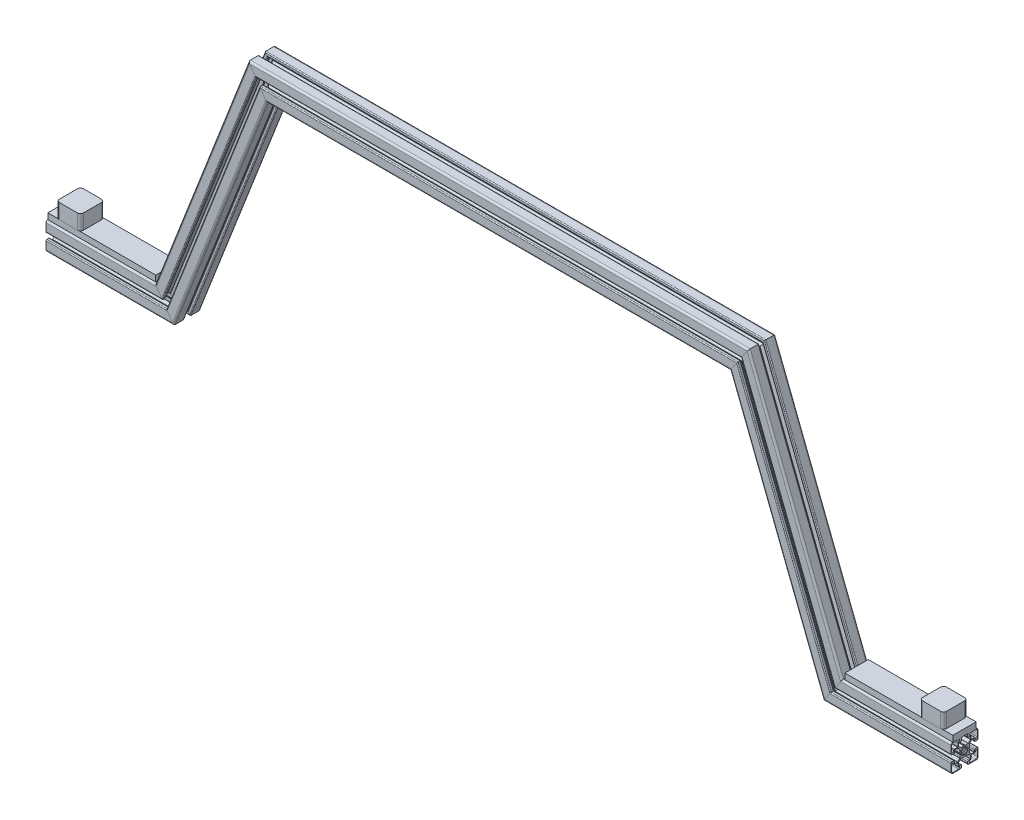
from build123d import *

# Parameters (mm, degrees)
SKETCH3_W            = 180.28743450691564
SKETCH3_H            = 38.99999999999999
BOSS_EXTRUDE1_DEPTH  = 10
BOSS_EXTRUDE2_DEPTH  = 25
FILLET1_R            = 5
FILLET1_OF_MIRROR1_R = 5


with BuildPart() as part:
    # Sweep1: sweep along a path in Sketch1
    with BuildLine(Plane.XY) as sweep1_path:
        Line((0, 0), (200, 0))
        Line((200, 0), (355.8974358974359, 400))
        Line((355.8974358974359, 400), (755.8974358974359, 400))
    # Sketch5 → Sweep1 (sweep)
    with BuildSketch(Plane(origin=(0, 0, 0), x_dir=(0, 0, -1), z_dir=(1, 0, 0))):
        with BuildLine():
            Line((4.905816029016867, 11.21531925961758), (4.005816102684597, 10.70017121598502))
            Line((4.005816102684597, 10.70017121598502), (3.105816176352211, 11.21531925961758))
            Line((3.105816176352211, 11.21531925961758), (-2.1975082146962652, 11.215319259617562))
            ThreePointArc((-2.1975082146962652, 11.215319259617562), (-2.3429279189949894, 11.244245037263257), (-2.4662087915471362, 11.326618682766647))
            Line((-2.4662087915471362, 11.326618682766647), (-5.932884474166096, 14.79329436538555))
            ThreePointArc((-5.932884474166096, 14.79329436538555), (-6.015258119669531, 14.9165752379377), (-6.044183897315248, 15.06199494223645))
            Line((-6.044183897315248, 15.06199494223645), (-6.044183897315358, 19.35531925961757))
            ThreePointArc((-6.044183897315358, 19.35531925961757), (-5.93288447416625, 19.62401983646846), (-5.664183897315362, 19.73531925961757))
            Line((-5.664183897315362, 19.73531925961757), (-2.5791838973153265, 19.73531925961757))
            ThreePointArc((-2.5791838973153265, 19.73531925961757), (-1.5043815899117716, 20.180516952214003), (-1.0591838973153256, 21.25531925961755))
            Line((-1.0591838973153256, 21.25531925961755), (-1.059183897315572, 24.21531925961759))
            ThreePointArc((-1.059183897315572, 24.21531925961759), (-1.504381589912015, 25.290121567021124), (-2.579183897315554, 25.73531925961756))
            Line((-2.579183897315554, 25.73531925961756), (-15.4941838973154, 25.73531925961757))
            ThreePointArc((-15.4941838973154, 25.73531925961757), (-17.61550424087504, 24.85663960317721), (-18.4941838973154, 22.735319259617572))
            Line((-18.4941838973154, 22.735319259617572), (-18.4941838973154, 9.820319259617662))
            ThreePointArc((-18.4941838973154, 9.820319259617662), (-18.048986204718968, 8.745516952214107), (-16.97418389731542, 8.300319259617662))
            Line((-16.97418389731542, 8.300319259617662), (-14.014183897315382, 8.300319259617766))
            ThreePointArc((-14.014183897315382, 8.300319259617766), (-12.939381589911845, 8.745516952214206), (-12.494183897315379, 9.820319259617733))
            Line((-12.494183897315379, 9.820319259617733), (-12.4941838973154, 12.90531925961758))
            ThreePointArc((-12.4941838973154, 12.90531925961758), (-12.382884474166298, 13.17401983646847), (-12.11418389731541, 13.285319259617582))
            Line((-12.11418389731541, 13.285319259617582), (-7.81378851212248, 13.28531925961746))
            ThreePointArc((-7.81378851212248, 13.28531925961746), (-7.668368807823728, 13.256393481971749), (-7.545087935271565, 13.17401983646833))
            Line((-7.545087935271565, 13.17401983646833), (-4.08548332046457, 9.714415221661511))
            ThreePointArc((-4.08548332046457, 9.714415221661511), (-4.003109674961121, 9.591134349109351), (-3.974183897315418, 9.445714644810582))
            Line((-3.974183897315418, 9.445714644810582), (-3.9741838973154215, 4.135318894911249))
            Line((-3.9741838973154215, 4.135318894911249), (-3.454570627598921, 3.235319259617511))
            Line((-3.454570627598921, 3.235319259617511), (-3.9741838973154215, 2.335319624323374))
            Line((-3.9741838973154215, 2.335319624323374), (-3.9741838973154215, -2.968005057763236))
            ThreePointArc((-3.9741838973154215, -2.968005057763236), (-4.003109674961133, -3.1134247620619817), (-4.0854833204645455, -3.236705634614141))
            Line((-4.0854833204645455, -3.236705634614141), (-7.55215900308344, -6.703381317233124))
            ThreePointArc((-7.55215900308344, -6.703381317233124), (-7.675439875635574, -6.785754962736517), (-7.820859579934288, -6.81468074038222))
            Line((-7.820859579934288, -6.81468074038222), (-12.11418389731541, -6.814680740382358))
            ThreePointArc((-12.11418389731541, -6.814680740382358), (-12.382884474166277, -6.703381317233245), (-12.494183897315413, -6.4346807403823885))
            Line((-12.494183897315413, -6.4346807403823885), (-12.4941838973154, -3.349680740382297))
            ThreePointArc((-12.4941838973154, -3.349680740382297), (-12.939381589911832, -2.274878432978741), (-14.014183897315382, -1.8296807403822957))
            Line((-14.014183897315382, -1.8296807403822957), (-16.97418389731542, -1.829680740382543))
            ThreePointArc((-16.97418389731542, -1.829680740382543), (-18.04898620471899, -2.2748784329789906), (-18.49418389731542, -3.349680740382567))
            Line((-18.49418389731542, -3.349680740382567), (-18.4941838973154, -16.26468074038243))
            ThreePointArc((-18.4941838973154, -16.26468074038243), (-17.615504240875044, -18.386001083942077), (-15.4941838973154, -19.264680740382435))
            Line((-15.4941838973154, -19.264680740382435), (-2.57918389731544, -19.26468074038243))
            ThreePointArc((-2.57918389731544, -19.26468074038243), (-1.5043815899118904, -18.819483047785972), (-1.059183897315442, -17.74468074038242))
            Line((-1.059183897315442, -17.74468074038242), (-1.059183897315572, -14.78468074038241))
            ThreePointArc((-1.059183897315572, -14.78468074038241), (-1.5043815899120052, -13.709878432978856), (-2.579183897315554, -13.264680740382412))
            Line((-2.579183897315554, -13.264680740382412), (-5.664183897315362, -13.26468074038243))
            ThreePointArc((-5.664183897315362, -13.26468074038243), (-5.932884474166251, -13.15338131723332), (-6.044183897315363, -12.884680740382432))
            Line((-6.044183897315363, -12.884680740382432), (-6.044183897315244, -8.58428535518951))
            ThreePointArc((-6.044183897315244, -8.58428535518951), (-6.015258119669534, -8.438865650890763), (-5.932884474166121, -8.315584778338604))
            Line((-5.932884474166121, -8.315584778338604), (-2.473279859359261, -4.85598016353157))
            ThreePointArc((-2.473279859359261, -4.85598016353157), (-2.3499989868071354, -4.77360651802815), (-2.204579282508414, -4.744680740382445))
            Line((-2.204579282508414, -4.744680740382445), (3.105816176352211, -4.74468074038245))
            Line((3.105816176352211, -4.74468074038245), (4.005816102684597, -4.229532696749942))
            Line((4.005816102684597, -4.229532696749942), (4.9058160290169806, -4.74468074038245))
            Line((4.9058160290169806, -4.74468074038245), (10.20914042006546, -4.744680740382422))
            ThreePointArc((10.20914042006546, -4.744680740382422), (10.354560124364177, -4.773606518028121), (10.47784099691632, -4.855980163531502))
            Line((10.47784099691632, -4.855980163531502), (13.944516679535292, -8.322655846150411))
            ThreePointArc((13.944516679535292, -8.322655846150411), (14.02689032503872, -8.445936718702562), (14.05581610268444, -8.591356423001304))
            Line((14.05581610268444, -8.591356423001304), (14.05581610268455, -12.884680740382432))
            ThreePointArc((14.05581610268455, -12.884680740382432), (13.944516679535438, -13.153381317233318), (13.67581610268455, -13.26468074038243))
            Line((13.67581610268455, -13.26468074038243), (10.59081610268452, -13.26468074038243))
            ThreePointArc((10.59081610268452, -13.26468074038243), (9.516013795280966, -13.70987843297886), (9.070816102684521, -14.78468074038241))
            Line((9.070816102684521, -14.78468074038241), (9.070816102684764, -17.74468074038245))
            ThreePointArc((9.070816102684764, -17.74468074038245), (9.5160137952812, -18.819483047785987), (10.59081610268474, -19.264680740382424))
            Line((10.59081610268474, -19.264680740382424), (23.50581610268459, -19.26468074038243))
            ThreePointArc((23.50581610268459, -19.26468074038243), (25.627136446244233, -18.386001083942073), (26.50581610268459, -16.26468074038243))
            Line((26.50581610268459, -16.26468074038243), (26.50581610268448, -3.349680740382411))
            ThreePointArc((26.50581610268448, -3.349680740382411), (26.060618410088097, -2.2748784329789036), (24.985816102684634, -1.8296807403824098))
            Line((24.985816102684634, -1.8296807403824098), (22.02581610268446, -1.829680740382515))
            ThreePointArc((22.02581610268446, -1.829680740382515), (20.951013795280893, -2.2748784329789853), (20.50581610268446, -3.349680740382567))
            Line((20.50581610268446, -3.349680740382567), (20.50581610268448, -6.434680740382334))
            ThreePointArc((20.50581610268448, -6.434680740382334), (20.394516679535418, -6.703381317233182), (20.125816102684606, -6.814680740382337))
            Line((20.125816102684606, -6.814680740382337), (15.825420717491562, -6.814680740382217))
            ThreePointArc((15.825420717491562, -6.814680740382217), (15.680001013192856, -6.7857549627365215), (15.556720140640715, -6.703381317233152))
            Line((15.556720140640715, -6.703381317233152), (12.09711552583365, -3.24377670242626))
            ThreePointArc((12.09711552583365, -3.24377670242626), (12.014741880330227, -3.120495829874147), (11.985816102684492, -2.975076125575442))
            Line((11.985816102684492, -2.975076125575442), (11.9858161026845, 2.335319624323545))
            Line((11.9858161026845, 2.335319624323545), (11.46620283296811, 3.235319259617624))
            Line((11.46620283296811, 3.235319259617624), (11.98581610268461, 4.135318894911704))
            Line((11.98581610268461, 4.135318894911704), (11.98581610268461, 9.438643576998516))
            ThreePointArc((11.98581610268461, 9.438643576998516), (12.014741880330329, 9.584063281297267), (12.097115525833749, 9.70734415384943))
            Line((12.097115525833749, 9.70734415384943), (15.563791208452631, 13.174019836468371))
            ThreePointArc((15.563791208452631, 13.174019836468371), (15.687072081004764, 13.256393481971767), (15.832491785303478, 13.28531925961747))
            Line((15.832491785303478, 13.28531925961747), (20.1258161026846, 13.28531925961761))
            ThreePointArc((20.1258161026846, 13.28531925961761), (20.394516679535503, 13.174019836468457), (20.5058161026846, 12.905319259617526))
            Line((20.5058161026846, 12.905319259617526), (20.50581610268459, 9.820319259617548))
            ThreePointArc((20.50581610268459, 9.820319259617548), (20.951013795281032, 8.745516952213997), (22.02581610268458, 8.300319259617549))
            Line((22.02581610268458, 8.300319259617549), (24.98581610268461, 8.300319259617792))
            ThreePointArc((24.98581610268461, 8.300319259617792), (26.06061841008815, 8.74551695221421), (26.50581610268461, 9.820319259617733))
            Line((26.50581610268461, 9.820319259617733), (26.5058161026846, 22.735319259617572))
            ThreePointArc((26.5058161026846, 22.735319259617572), (25.627136446244233, 24.85663960317721), (23.50581610268459, 25.73531925961757))
            Line((23.50581610268459, 25.73531925961757), (10.59081610268463, 25.73531925961757))
            ThreePointArc((10.59081610268463, 25.73531925961757), (9.51601379528108, 25.29012156702114), (9.070816102684635, 24.21531925961759))
            Line((9.070816102684635, 24.21531925961759), (9.070816102684764, 21.25531925961758))
            ThreePointArc((9.070816102684764, 21.25531925961758), (9.51601379528119, 20.18051695221402), (10.59081610268474, 19.735319259617576))
            Line((10.59081610268474, 19.735319259617576), (13.67581610268455, 19.73531925961757))
            ThreePointArc((13.67581610268455, 19.73531925961757), (13.944516679535438, 19.624019836468456), (14.055816102684554, 19.35531925961757))
            Line((14.055816102684554, 19.35531925961757), (14.055816102684432, 15.05492387442464))
            ThreePointArc((14.055816102684432, 15.05492387442464), (14.026890325038721, 14.909504170125889), (13.944516679535301, 14.786223297573725))
            Line((13.944516679535301, 14.786223297573725), (10.484912064728451, 11.326618682766702))
            ThreePointArc((10.484912064728451, 11.326618682766702), (10.361631192176315, 11.244245037263312), (10.2162114878776, 11.215319259617608))
            Line((10.2162114878776, 11.215319259617608), (4.905816029016867, 11.21531925961758))
        make_face()
        with BuildLine():
            Line((13.969837884314126, 21.274341041247055), (13.529837884314462, 21.274341041247))
            ThreePointArc((13.529837884314462, 21.274341041247), (12.46917771253464, 21.713680869467176), (12.02983788431446, 22.774341041247))
            Line((12.02983788431446, 22.774341041247), (12.02983788431446, 23.27434104124714))
            ThreePointArc((12.02983788431446, 23.27434104124714), (12.469177712534641, 24.335001213026963), (13.529837884314462, 24.77434104124714))
            Line((13.529837884314462, 24.77434104124714), (23.1398378843142, 24.77434104124711))
            ThreePointArc((23.1398378843142, 24.77434104124711), (24.752041345419528, 24.10654450235244), (25.4198378843142, 22.49434104124711))
            Line((25.4198378843142, 22.49434104124711), (25.41983788431417, 12.8843410412473))
            ThreePointArc((25.41983788431417, 12.8843410412473), (24.98049805609399, 11.823680869467479), (23.91983788431417, 11.384341041247298))
            Line((23.91983788431417, 11.384341041247298), (23.41983788431416, 11.38434104124724))
            ThreePointArc((23.41983788431416, 11.38434104124724), (22.359177712534358, 11.823680869467406), (21.919837884314166, 12.884341041247197))
            Line((21.919837884314166, 12.884341041247197), (21.919837884314173, 13.32434104124721))
            ThreePointArc((21.919837884314173, 13.32434104124721), (21.62694466550073, 14.031447822433739), (20.919837884314216, 14.32434104124721))
            Line((20.919837884314216, 14.32434104124721), (15.34983788431423, 14.324341041247353))
            ThreePointArc((15.34983788431423, 14.324341041247353), (15.08113730746334, 14.435640464396453), (14.969837884314229, 14.70434104124734))
            Line((14.969837884314229, 14.70434104124734), (14.96983788431424, 20.27434104124706))
            ThreePointArc((14.96983788431424, 20.27434104124706), (14.676944665500747, 20.981447822433648), (13.969837884314126, 21.274341041247055))
        make_face(mode=Mode.SUBTRACT)
        with BuildLine():
            Line((21.95885966594362, -6.689680740382415), (21.95885966594362, -6.249680740382729))
            ThreePointArc((21.95885966594362, -6.249680740382729), (22.398199494163798, -5.189020568602908), (23.45885966594362, -4.74968074038273))
            Line((23.45885966594362, -4.74968074038273), (23.958859665943745, -4.749680740382729))
            ThreePointArc((23.958859665943745, -4.749680740382729), (25.01951983772356, -5.189020568602912), (25.458859665943738, -6.249680740382729))
            Line((25.458859665943738, -6.249680740382729), (25.45885966594368, -15.859680740382462))
            ThreePointArc((25.45885966594368, -15.859680740382462), (24.791063127048982, -17.471884201487782), (23.17885966594365, -18.13968074038246))
            Line((23.17885966594365, -18.13968074038246), (13.56885966594387, -18.13968074038243))
            ThreePointArc((13.56885966594387, -18.13968074038243), (12.50819949416405, -17.70034091216225), (12.068859665943872, -16.63968074038243))
            Line((12.068859665943872, -16.63968074038243), (12.06885966594381, -16.13968074038244))
            ThreePointArc((12.06885966594381, -16.13968074038244), (12.508199494163975, -15.079020568602633), (13.568859665943767, -14.63968074038244))
            Line((13.568859665943767, -14.63968074038244), (14.008859665943811, -14.63968074038243))
            ThreePointArc((14.008859665943811, -14.63968074038243), (14.715966447130349, -14.346787521568986), (15.008859665943808, -13.639680740382458))
            Line((15.008859665943808, -13.639680740382458), (15.00885966594392, -8.069680740382497))
            ThreePointArc((15.00885966594392, -8.069680740382497), (15.120159089093024, -7.800980163531606), (15.38885966594391, -7.689680740382494))
            Line((15.38885966594391, -7.689680740382494), (20.95885966594362, -7.6896807403825))
            ThreePointArc((20.95885966594362, -7.6896807403825), (21.6659664471302, -7.396787521569017), (21.95885966594362, -6.689680740382415))
        make_face(mode=Mode.SUBTRACT)
        with BuildLine():
            Line((-6.005162115685757, -14.678702522011942), (-5.565162115686073, -14.67870252201189))
            ThreePointArc((-5.565162115686073, -14.67870252201189), (-4.504501943906252, -15.118042350232068), (-4.065162115686071, -16.17870252201189))
            Line((-4.065162115686071, -16.17870252201189), (-4.065162115686073, -16.67870252201203))
            ThreePointArc((-4.065162115686073, -16.67870252201203), (-4.504501943906252, -17.739362693791854), (-5.565162115686073, -18.17870252201203))
            Line((-5.565162115686073, -18.17870252201203), (-15.175162115685803, -18.178702522012))
            ThreePointArc((-15.175162115685803, -18.178702522012), (-16.787365576791128, -17.510905983117325), (-17.4551621156858, -15.898702522012))
            Line((-17.4551621156858, -15.898702522012), (-17.4551621156858, -6.288702522012187))
            ThreePointArc((-17.4551621156858, -6.288702522012187), (-17.01582228746562, -5.228042350232365), (-15.9551621156858, -4.788702522012187))
            Line((-15.9551621156858, -4.788702522012187), (-15.45516211568583, -4.788702522012131))
            ThreePointArc((-15.45516211568583, -4.788702522012131), (-14.394501943906025, -5.228042350232296), (-13.95516211568583, -6.2887025220120885))
            Line((-13.95516211568583, -6.2887025220120885), (-13.9551621156858, -6.7287025220121))
            ThreePointArc((-13.9551621156858, -6.7287025220121), (-13.662268896872359, -7.4358093031986385), (-12.955162115685829, -7.728702522012101))
            Line((-12.955162115685829, -7.728702522012101), (-7.385162115685895, -7.7287025220122425))
            ThreePointArc((-7.385162115685895, -7.7287025220122425), (-7.116461538835007, -7.84000194516135), (-7.005162115685896, -8.108702522012237))
            Line((-7.005162115685896, -8.108702522012237), (-7.005162115685843, -13.67870252201194))
            ThreePointArc((-7.005162115685843, -13.67870252201194), (-6.71226889687236, -14.385809303198519), (-6.005162115685757, -14.678702522011942))
        make_face(mode=Mode.SUBTRACT)
        with BuildLine():
            Line((1.828915921783154, -2.488564033794063), (1.413170132153103, -2.3163564892297765))
            ThreePointArc((1.413170132153103, -2.3163564892297765), (0.8233361546720646, -1.6253071256103948), (1.0362699251979821, -0.7420673205067814))
            ThreePointArc((1.0362699251979821, -0.7420673205067814), (0.44670320424367826, -0.23761386930494943), (-0.05771663654724213, 0.351981608207141))
            ThreePointArc((-0.05771663654724213, 0.351981608207141), (-0.9409371706461417, 0.13910189708009613), (-1.6319522534634663, 0.7289276667633529))
            Line((-1.6319522534634663, 0.7289276667633529), (-1.8041597980277773, 1.144673456393433))
            ThreePointArc((-1.8041597980277773, 1.144673456393433), (-1.7325897121288976, 2.0503947527944133), (-0.957477943443773, 2.5243726953145917))
            ThreePointArc((-0.957477943443773, 2.5243726953145917), (-1.0176621136546347, 3.2979617778010164), (-0.9574338433371404, 4.071547428094972))
            ThreePointArc((-0.9574338433371404, 4.071547428094972), (-1.7324937595966465, 4.545549969724606), (-1.804045409097357, 5.451241222148561))
            Line((-1.804045409097357, 5.451241222148561), (-1.6318378645330658, 5.866987011778611))
            ThreePointArc((-1.6318378645330658, 5.866987011778611), (-0.940788500913663, 6.456820989259641), (-0.05754869581003179, 6.243887218733747))
            ThreePointArc((-0.05754869581003179, 6.243887218733747), (0.4469047553918468, 6.833453939687905), (1.0365002329039577, 7.337873780478677))
            ThreePointArc((1.0365002329039577, 7.337873780478677), (0.8236205217769148, 8.221094314577591), (1.4134462914601942, 8.912109397394914))
            Line((1.4134462914601942, 8.912109397394914), (1.8291920810902504, 9.084316941959186))
            ThreePointArc((1.8291920810902504, 9.084316941959186), (2.734913377491232, 9.012746856060335), (3.208891320011409, 8.23763508737521))
            ThreePointArc((3.208891320011409, 8.23763508737521), (3.982480402497697, 8.297819257585996), (4.7560660527915095, 8.237590987268506))
            ThreePointArc((4.7560660527915095, 8.237590987268506), (5.230068594421157, 9.01265090352799), (6.135759846845102, 9.084202553028694))
            Line((6.135759846845102, 9.084202553028694), (6.551505636475179, 8.911995008464404))
            ThreePointArc((6.551505636475179, 8.911995008464404), (7.141339613955897, 8.220945644845237), (6.928405843430371, 7.337705839741907))
            ThreePointArc((6.928405843430371, 7.337705839741907), (7.517972564384662, 6.83325238854008), (8.022392405175577, 6.243656911027995))
            ThreePointArc((8.022392405175577, 6.243656911027995), (8.90561293927449, 6.456536622155043), (9.59662802209183, 5.866710852471783))
            Line((9.59662802209183, 5.866710852471783), (9.768835566656085, 5.450965062841702))
            ThreePointArc((9.768835566656085, 5.450965062841702), (9.697265480757252, 4.545243766440708), (8.922153712072108, 4.071265823920541))
            ThreePointArc((8.922153712072108, 4.071265823920541), (8.982337882282934, 3.2976767414341053), (8.922109611965613, 2.5240910911401406))
            ThreePointArc((8.922109611965613, 2.5240910911401406), (9.697169528224983, 2.050088549510487), (9.76872117772571, 1.1443972970866416))
            Line((9.76872117772571, 1.1443972970866416), (9.596513633161447, 0.7286515074565642))
            ThreePointArc((9.596513633161447, 0.7286515074565642), (8.905464269542016, 0.13881752997559105), (8.022224464438398, 0.3517513005014714))
            ThreePointArc((8.022224464438398, 0.3517513005014714), (7.517771013236633, -0.23781542045279824), (6.928175535724686, -0.7422352612437741))
            ThreePointArc((6.928175535724686, -0.7422352612437741), (7.14105524685153, -1.6254557953426318), (6.551229477168359, -2.3164708781599113))
            Line((6.551229477168359, -2.3164708781599113), (6.1354836875382786, -2.4886784227241967))
            ThreePointArc((6.1354836875382786, -2.4886784227241967), (5.229762391137301, -2.4171083368253283), (4.755784448617146, -1.641996568140192))
            ThreePointArc((4.755784448617146, -1.641996568140192), (3.982195366130722, -1.7021807383512026), (3.2086097158367415, -1.6419524680338808))
            ThreePointArc((3.2086097158367415, -1.6419524680338808), (2.734607174207096, -2.4170123842933635), (1.828915921783154, -2.488564033794063))
        make_face(mode=Mode.SUBTRACT)
        with BuildLine():
            Line((-13.99418389731535, 13.285319259617525), (-13.99418389731529, 12.84531925961784))
            ThreePointArc((-13.99418389731529, 12.84531925961784), (-14.43352372553547, 11.784659087838019), (-15.49418389731529, 11.34531925961784))
            Line((-15.49418389731529, 11.34531925961784), (-15.994183897315432, 11.34531925961784))
            ThreePointArc((-15.994183897315432, 11.34531925961784), (-17.05484406909525, 11.78465908783802), (-17.49418389731543, 12.84531925961784))
            Line((-17.49418389731543, 12.84531925961784), (-17.4941838973154, 22.45531925961757))
            ThreePointArc((-17.4941838973154, 22.45531925961757), (-16.826387358420728, 24.0675227207229), (-15.2141838973154, 24.735319259617572))
            Line((-15.2141838973154, 24.735319259617572), (-5.604183897315587, 24.73531925961757))
            ThreePointArc((-5.604183897315587, 24.73531925961757), (-4.543523725535764, 24.29597943139739), (-4.104183897315586, 23.23531925961757))
            Line((-4.104183897315586, 23.23531925961757), (-4.104183897315531, 22.735319259617572))
            ThreePointArc((-4.104183897315531, 22.735319259617572), (-4.543523725535693, 21.674659087837767), (-5.604183897315486, 21.235319259617572))
            Line((-5.604183897315486, 21.235319259617572), (-6.0441838973155, 21.23531925961757))
            ThreePointArc((-6.0441838973155, 21.23531925961757), (-6.751290678502038, 20.942426040804126), (-7.0441838973155, 20.235319259617597))
            Line((-7.0441838973155, 20.235319259617597), (-7.044183897315642, 14.66531925961763))
            ThreePointArc((-7.044183897315642, 14.66531925961763), (-7.155483320464751, 14.396618682766743), (-7.424183897315638, 14.28531925961763))
            Line((-7.424183897315638, 14.28531925961763), (-12.99418389731535, 14.28531925961758))
            ThreePointArc((-12.99418389731535, 14.28531925961758), (-13.701290678501918, 13.992426040804109), (-13.99418389731535, 13.285319259617525))
        make_face(mode=Mode.SUBTRACT)
    sweep1 = sweep(path=sweep1_path.line, transition=Transition.RIGHT)

    # Sketch3 → Boss-Extrude1 (add)
    with BuildSketch(Plane(origin=(0, 25.73531925961756, -1.383e-14), x_dir=(1, 0, 0), z_dir=(0, 1, -5.4e-16))):
        with Locations((90.14371725345782, 4.005816102684581)):
            Rectangle(SKETCH3_W, SKETCH3_H)
    boss_extrude1 = extrude(amount=BOSS_EXTRUDE1_DEPTH)

    # Sketch4 → Boss-Extrude2 (add)
    with BuildSketch(Plane(origin=(0, 35.73531925961756, -1.907e-14), x_dir=(1, 0, 0), z_dir=(0, 1, 1.702e-14))):
        Polygon((15.000000000000009, -15.994183897315422), (55.00000000000001, -15.994183897315418), (55.00000000000001, 24.00581610268458), (15.000000000000009, 24.00581610268458), align=None)
    boss_extrude2 = extrude(amount=BOSS_EXTRUDE2_DEPTH)

    # Fillet1
    # the kernel refuses this fillet: 5 mm, written as the material it takes off along each edge
    with BuildSketch(Plane(origin=(55.00000000000001, 35.73531925961729, 15.994183897315398), x_dir=(0, 1.702e-14, -1), z_dir=(0, 1, 1.702e-14))) as fillet1_piece_1:
        with BuildLine():
            CenterArc((FILLET1_R, FILLET1_R), FILLET1_R, 180, 90)
            Line((0, FILLET1_R), (0, 0))
            Line((0, 0), (FILLET1_R, 0))
        make_face()
    extrude(amount=37.49999999999999, mode=Mode.SUBTRACT)
    with BuildSketch(Plane(origin=(55.00000000000001, 35.73531925961797, -24.005816102684598), x_dir=(-1, 0, 0), z_dir=(0, 1, 1.702e-14))) as fillet1_piece_2:
        with BuildLine():
            CenterArc((FILLET1_R, FILLET1_R), FILLET1_R, 180.00000000000003, 90)
            Line((0, FILLET1_R), (0, 0))
            Line((0, 0), (FILLET1_R, 0))
        make_face()
    extrude(amount=37.5, mode=Mode.SUBTRACT)
    with BuildSketch(Plane(origin=(15.000000000000009, 35.73531925961797, -24.005816102684598), x_dir=(-3.6e-16, -1.702e-14, 1), z_dir=(0, 1, 1.702e-14))) as fillet1_piece_3:
        with BuildLine():
            CenterArc((FILLET1_R, FILLET1_R), FILLET1_R, 180.00000000000003, 90)
            Line((-1.78e-15, FILLET1_R), (0, 0))
            Line((0, 0), (FILLET1_R, 0))
        make_face()
    extrude(amount=37.5, mode=Mode.SUBTRACT)
    with BuildSketch(Plane(origin=(15.000000000000009, 35.73531925961729, 15.994183897315402), x_dir=(-3.6e-16, 1.702e-14, -1), z_dir=(0, 1, 1.702e-14))) as fillet1_piece_4:
        with BuildLine():
            CenterArc((FILLET1_R, -FILLET1_R), FILLET1_R, 89.99999999999999, 90.00000000000006)
            Line((-1.78e-15, -FILLET1_R), (0, 0))
            Line((0, 0), (FILLET1_R, 0))
        make_face()
    extrude(amount=37.50000000000002, mode=Mode.SUBTRACT)

    # Mirror1: Sweep1, Boss-Extrude1, Boss-Extrude2 across plane
    add(sweep1.mirror(Plane(origin=(755.8974358974358, 0, 0), x_dir=(0, 0, 1), z_dir=(1, 0, 0))))
    add(boss_extrude1.mirror(Plane(origin=(755.8974358974358, 0, 0), x_dir=(0, 0, 1), z_dir=(1, 0, 0))))
    add(boss_extrude2.mirror(Plane(origin=(755.8974358974358, 0, 0), x_dir=(0, 0, 1), z_dir=(1, 0, 0))))

    # Fillet1 of Mirror1
    # the kernel refuses this fillet: 5 mm, written as the material it takes off along each edge
    with BuildSketch(Plane(origin=(1456.7948717948716, 35.73531925961729, 15.994183897315398), x_dir=(0, 1.702e-14, -1), z_dir=(0, 1, 1.702e-14))) as fillet1_of_mirror1_piece_1:
        with BuildLine():
            CenterArc((FILLET1_OF_MIRROR1_R, -FILLET1_OF_MIRROR1_R), FILLET1_OF_MIRROR1_R, 90, 90)
            Line((0, -FILLET1_OF_MIRROR1_R), (0, 0))
            Line((0, 0), (FILLET1_OF_MIRROR1_R, 0))
        make_face()
    extrude(amount=37.49999999999999, mode=Mode.SUBTRACT)
    with BuildSketch(Plane(origin=(1456.7948717948716, 35.73531925961797, -24.005816102684598), x_dir=(1, 0, 0), z_dir=(0, 1, 1.702e-14))) as fillet1_of_mirror1_piece_2:
        with BuildLine():
            CenterArc((FILLET1_OF_MIRROR1_R, -FILLET1_OF_MIRROR1_R), FILLET1_OF_MIRROR1_R, 90, 89.99999999999997)
            Line((0, -FILLET1_OF_MIRROR1_R), (0, 0))
            Line((0, 0), (FILLET1_OF_MIRROR1_R, 0))
        make_face()
    extrude(amount=37.5, mode=Mode.SUBTRACT)
    with BuildSketch(Plane(origin=(1496.7948717948716, 35.73531925961797, -24.005816102684598), x_dir=(0, -1.702e-14, 1), z_dir=(0, 1, 1.702e-14))) as fillet1_of_mirror1_piece_3:
        with BuildLine():
            CenterArc((FILLET1_OF_MIRROR1_R, -FILLET1_OF_MIRROR1_R), FILLET1_OF_MIRROR1_R, 90, 90)
            Line((0, -FILLET1_OF_MIRROR1_R), (0, 0))
            Line((0, 0), (FILLET1_OF_MIRROR1_R, 0))
        make_face()
    extrude(amount=37.5, mode=Mode.SUBTRACT)
    with BuildSketch(Plane(origin=(1496.7948717948716, 35.73531925961729, 15.994183897315402), x_dir=(0, 1.702e-14, -1), z_dir=(0, 1, 1.702e-14))) as fillet1_of_mirror1_piece_4:
        with BuildLine():
            CenterArc((FILLET1_OF_MIRROR1_R, FILLET1_OF_MIRROR1_R), FILLET1_OF_MIRROR1_R, 180, 90)
            Line((0, FILLET1_OF_MIRROR1_R), (0, 0))
            Line((0, 0), (FILLET1_OF_MIRROR1_R, 0))
        make_face()
    extrude(amount=37.49999999999999, mode=Mode.SUBTRACT)


solid = part.part
